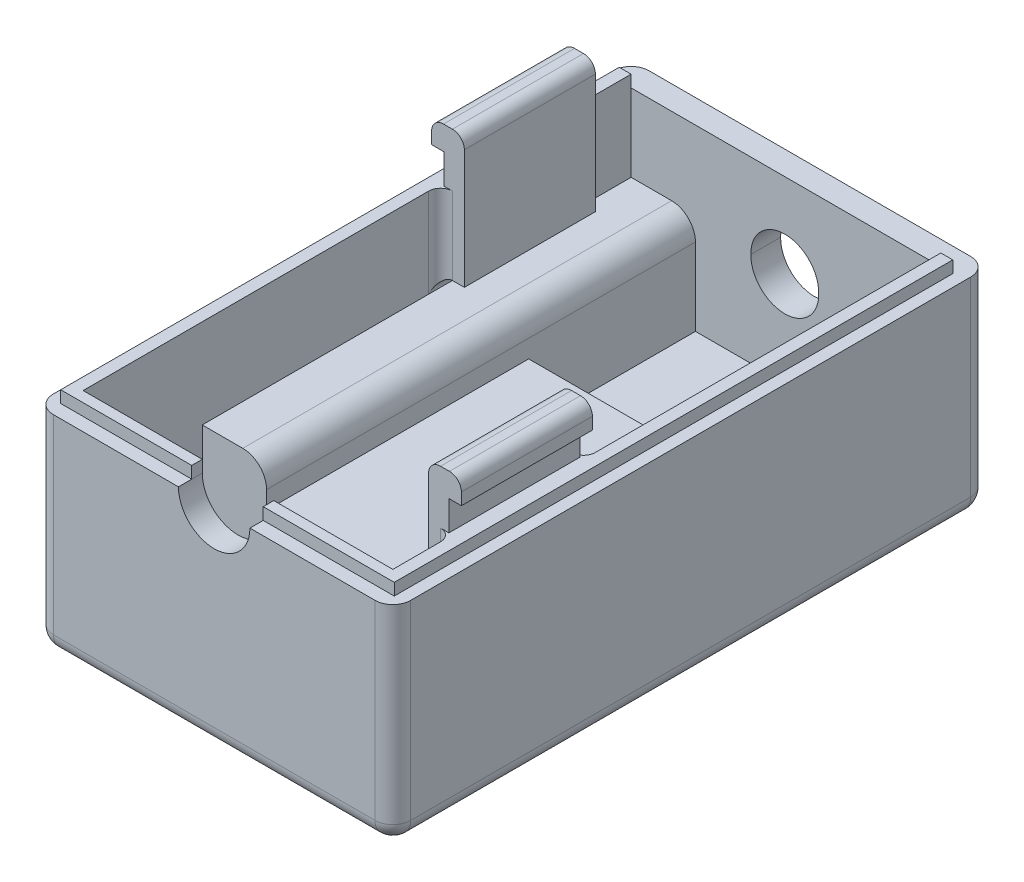
from build123d import *

# Parameters (mm, degrees)
BOSS_EXTRUDE1_DEPTH      = 17.5
CUT_EXTRUDE1_DEPTH       = 14
CUT_EXTRUDE2_DEPTH       = 54.247065647
SKETCH4_W                = 26
SKETCH4_H                = 8
CUT_EXTRUDE3_DEPTH       = 1
BOSS_EXTRUDE3_DEPTH      = 7.5
BOSS_EXTRUDE3_DEPTH_BACK = 1
SKETCH6_W                = 5.4
SKETCH6_H                = 36
FILLET2_R                = 2
FILLET5_R                = 1.5
SKETCH13_W               = 15.2
SKETCH13_H               = 28
BOSS_EXTRUDE7_DEPTH      = 4
SKETCH15_R               = 1
CUT_EXTRUDE8_DEPTH       = 6
CHAMFER5_SIZE            = 6
SKETCH16_W               = 11
SKETCH16_H               = 5.5
BOSS_EXTRUDE8_DEPTH      = 2
SKETCH17_W               = 11
SKETCH17_H               = 5.5
BOSS_EXTRUDE9_DEPTH      = 2
BOSS_EXTRUDE14_START     = -2
BOSS_EXTRUDE14_DEPTH     = 0.5
CHAMFER6_SIZE            = 0.5
BOSS_EXTRUDE15_DEPTH     = 0.5
CHAMFER7_SIZE            = 0.5
CUT_EXTRUDE9_REACH       = 59.483
BOSS_EXTRUDE16_DEPTH     = 1
FILLET7_R                = 1
SKETCH27_W               = 11
SKETCH27_H               = 2
BOSS_EXTRUDE17_DEPTH     = 0.75
SKETCH27_3_W             = 11
SKETCH27_3_H             = 2.5
CUT_EXTRUDE10_DEPTH      = 0.3
SKETCH29_W               = 11
SKETCH29_H               = 2
BOSS_EXTRUDE18_DEPTH     = 0.75
SKETCH29_4_W             = 11
SKETCH29_4_H             = 2.5
CUT_EXTRUDE11_DEPTH      = 0.3
FILLET8_R                = 1


# Some blends are built 0.0001 mm under size
with BuildPart() as part:
    # Sketch1 → Boss-Extrude1 (new body)
    with BuildSketch(Plane(origin=(0, 0, 0), x_dir=(1, 0, 0), z_dir=(0, 1, 0))):
        Polygon((-15, 20), (15, 20), (15, -20), (15, -30), (-15, -30), (-15, -20), align=None)
    extrude(amount=BOSS_EXTRUDE1_DEPTH)

    # Sketch2 → Cut-Extrude1 (cut)
    with BuildSketch(Plane(origin=(0, 17.5, 0), x_dir=(1, 0, 0), z_dir=(0, 1, 0))):
        Polygon((-13, 18), (13, 18), (13, -18), (13, -28), (-13, -28), (-13, -18), align=None)
    extrude(amount=-CUT_EXTRUDE1_DEPTH, mode=Mode.SUBTRACT)

    # Sketch3 → Cut-Extrude2 (cut, through all)
    with BuildSketch(Plane.XY.offset(-18)):
        with BuildLine():
            ThreePointArc((2.74956137, 10.425664385), (-0.1, 13.325664385), (-2.94956137, 10.425664385))
            ThreePointArc((-2.94956137, 10.425664385), (-0.1, 7.525664385), (2.74956137, 10.425664385))
        make_face()
    extrude(amount=-CUT_EXTRUDE2_DEPTH, mode=Mode.SUBTRACT)

    # Sketch4 → Cut-Extrude3 (cut)
    with BuildSketch(Plane(origin=(0, 3.5, 0), x_dir=(1, 0, 0), z_dir=(0, 1, 0))):
        with Locations((0, 14)):
            Rectangle(SKETCH4_W, SKETCH4_H)
    extrude(amount=-CUT_EXTRUDE3_DEPTH, mode=Mode.SUBTRACT)

    # Sketch6 → Boss-Extrude3 (add, two sides: drawn at the far end of the back side and taken through both)
    with BuildSketch(Plane(origin=(0, 3.5, 0), x_dir=(1, 0, 0), z_dir=(0, 1, 0)).offset(-BOSS_EXTRUDE3_DEPTH_BACK)):
        with Locations((-10.3, 0)):
            Rectangle(SKETCH6_W, SKETCH6_H)
        with Locations((10.3, 0)):
            Rectangle(SKETCH6_W, SKETCH6_H)
    extrude(amount=BOSS_EXTRUDE3_DEPTH + BOSS_EXTRUDE3_DEPTH_BACK)

    # Fillet2
    fillet2_edges = [part.edges().sort_by_distance(p)[0] for p in [
        (-7.6, 11, 0),
        (7.6, 11, 0),
    ]]
    fillet(fillet2_edges, radius=FILLET2_R)

    # Fillet5
    fillet5_edges = [part.edges().sort_by_distance(p)[0] for p in [
        (15, 8.75, 30),
        (-15, 8.75, 30),
        (-15, 8.75, -20),
        (15, 8.75, -20),
        (0, 0, 30),
        (-15, 0, 5),
        (0, 0, -20),
        (15, 0, 5),
    ]]
    fillet(fillet5_edges, radius=FILLET5_R)

    # Sketch13 → Boss-Extrude7 (add)
    with BuildSketch(Plane(origin=(0, 3.5, 0), x_dir=(1, 0, 0), z_dir=(0, 1, 0))):
        with Locations((0, -4)):
            Rectangle(SKETCH13_W, SKETCH13_H)
    extrude(amount=BOSS_EXTRUDE7_DEPTH)

    # Sketch15 → Cut-Extrude8 (cut)
    with BuildSketch(Plane(origin=(0, 7.5, 0), x_dir=(1, 0, 0), z_dir=(0, 1, 0))):
        with Locations(Location((0, -8.82, 0), (0, 0, 270))):
            Circle(SKETCH15_R)
    extrude(amount=-CUT_EXTRUDE8_DEPTH, mode=Mode.SUBTRACT)

    # Chamfer5
    # the kernel refuses this chamfer: 6 mm, written as the material it takes off along each edge
    with BuildSketch(Plane(origin=(-7.6, 7.5, -10), x_dir=(0, -0.9996219169112968, -0.02749587661058649), z_dir=(1, 0, 0))) as chamfer5_piece_1_section:
        Polygon((CHAMFER5_SIZE * 0.999621916911, -CHAMFER5_SIZE * 0.0274958766106), (-CHAMFER5_SIZE * 0.0274958766106, -CHAMFER5_SIZE * 0.999621916911), (0, 0), align=None)
    chamfer5_piece_1 = extrude(amount=15.2, mode=Mode.PRIVATE)
    chamfer5_piece_1 = split(chamfer5_piece_1, bisect_by=Plane(origin=(0, 2.5, -7.952380952), z_dir=(0, 1, 0)), keep=Keep.TOP, mode=Mode.PRIVATE)
    add(chamfer5_piece_1, mode=Mode.SUBTRACT)

    # Sketch16 → Boss-Extrude8 (add)
    with BuildSketch(Plane(origin=(-13, 0, 0), x_dir=(0, 0, -1), z_dir=(1, 0, 0))):
        Polygon((2, 17.5), (2, 14.5), (2, 12), (13, 12), (13, 14.5), (13, 17.5), align=None)
        with Locations((7.5, 20.25)):
            Rectangle(SKETCH16_W, SKETCH16_H)
    extrude(amount=BOSS_EXTRUDE8_DEPTH)

    # Sketch17 → Boss-Extrude9 (add)
    with BuildSketch(Plane.ZY.offset(-13)):
        with Locations((17.5, 20.25)):
            Rectangle(SKETCH17_W, SKETCH17_H)
        Polygon((12, 17.5), (12, 14.5), (12, 12), (23, 12), (23, 14.5), (23, 17.5), align=None)
    extrude(amount=BOSS_EXTRUDE9_DEPTH)

    # Sketch3<4> → Boss-Extrude14 (add)
    with BuildSketch(Plane.XY.offset(-18).offset(BOSS_EXTRUDE14_START)):
        Polygon((-4.129390667, 8.806636123), (-1.769028262, 6.446273719), (1.569028262, 6.446273719), (3.929390667, 8.806636123), (3.929390667, 12.144692648), (1.569028262, 14.505055052), (-1.769028262, 14.505055052), (-4.129390667, 12.144692648), align=None)
        with BuildLine():
            ThreePointArc((-2.94956137, 10.425664385), (-0.1, 7.525664385), (2.74956137, 10.425664385))
            ThreePointArc((2.74956137, 10.425664385), (-0.1, 13.325664385), (-2.94956137, 10.425664385))
        make_face(mode=Mode.SUBTRACT)
    extrude(amount=-BOSS_EXTRUDE14_DEPTH)

    # Chamfer6
    chamfer6_edges = [part.edges().sort_by_distance(p)[0] for p in [
        (2.749209465, 13.32487385, -20.5),
        (3.929390667, 10.475664385, -20.5),
        (2.749209465, 7.626454921, -20.5),
        (-0.1, 6.446273719, -20.5),
        (-2.949209465, 7.626454921, -20.5),
        (-4.129390667, 10.475664385, -20.5),
        (-2.949209465, 13.32487385, -20.5),
        (-0.1, 14.505055052, -20.5),
    ]]
    chamfer(chamfer6_edges, length=CHAMFER6_SIZE - 0.0001)  # a hair under: the kernel refuses the full size

    # Sketch23 → Boss-Extrude15 (add)
    with BuildSketch(Plane.XZ):
        Polygon((-12, 17), (-12, -17), (12, -17), (12, 17), (12, 27), (-12, 27), align=None)
    extrude(amount=BOSS_EXTRUDE15_DEPTH)

    # Chamfer7
    chamfer7_edges = [part.edges().sort_by_distance(p)[0] for p in [
        (12, -0.5, 5),
        (-12, -0.5, 5),
        (0, -0.5, -17),
        (0, -0.5, 27),
    ]]
    chamfer(chamfer7_edges, length=CHAMFER7_SIZE - 0.0001)  # a hair under: the kernel refuses the full size

    # Sketch24 → Cut-Extrude9 (cut, up to next)
    with BuildSketch(Plane.XY.offset(30), mode=Mode.PRIVATE) as cut_extrude9_sk1:
        with BuildLine():
            Line((-3, 17.5), (3, 17.5))
            ThreePointArc((3, 17.5), (0, 14.5), (-3, 17.5))
        make_face()
    cut_extrude9_tool1 = extrude(cut_extrude9_sk1.sketch, amount=-CUT_EXTRUDE9_REACH, mode=Mode.PRIVATE) & part.part
    add(cut_extrude9_tool1.solids().sort_by_distance((0, 16.22676, 30))[0], mode=Mode.SUBTRACT)

    # Sketch26 → Boss-Extrude16 (add)
    with BuildSketch(Plane(origin=(0, 17.5, 0), x_dir=(1, 0, 0), z_dir=(0, 1, 0))):
        Polygon((-13, 13), (-13, 18), (-14, 18), (-14, -19.115845085), (-14, -28.884154915), (-3, -28.884154915), (-3, -28), (-13, -28), (-13, 2), align=None)
        Polygon((3, -28), (13, -28), (13, 18), (14, 18), (14, -28.884154915), (3, -28.884154915), align=None)
    extrude(amount=BOSS_EXTRUDE16_DEPTH)

    # Fillet7
    fillet7_edges = [part.edges().sort_by_distance(p)[0] for p in [
        (-13, 15.25, -13),
        (-13, 15.25, -2),
        (-13, 12, -7.5),
        (13, 15.25, 12),
        (13, 12, 17.5),
        (13, 15.25, 23),
        (0, 3.5, 18),
    ]]
    fillet(fillet7_edges, radius=FILLET7_R - 0.0001)  # a hair under: the kernel refuses the full size

    # Sketch27 → Boss-Extrude17 (add)
    with BuildSketch(Plane.ZY.offset(13)):
        with Locations((-7.5, 22)):
            Rectangle(SKETCH27_W, SKETCH27_H)
    extrude(amount=BOSS_EXTRUDE17_DEPTH)

    # Sketch27<3> → Cut-Extrude10 (cut)
    with BuildSketch(Plane.ZY.offset(13)):
        with Locations((-7.5, 19.75)):
            Rectangle(SKETCH27_3_W, SKETCH27_3_H)
    extrude(amount=-CUT_EXTRUDE10_DEPTH, mode=Mode.SUBTRACT)

    # Sketch29 → Boss-Extrude18 (add)
    with BuildSketch(Plane(origin=(13, 0, 0), x_dir=(0, 0, -1), z_dir=(1, 0, 0))):
        with Locations((-17.5, 22)):
            Rectangle(SKETCH29_W, SKETCH29_H)
    extrude(amount=BOSS_EXTRUDE18_DEPTH)

    # Sketch29<4> → Cut-Extrude11 (cut)
    with BuildSketch(Plane(origin=(13, 0, 0), x_dir=(0, 0, -1), z_dir=(1, 0, 0))):
        with Locations((-17.5, 19.75)):
            Rectangle(SKETCH29_4_W, SKETCH29_4_H)
    extrude(amount=-CUT_EXTRUDE11_DEPTH, mode=Mode.SUBTRACT)

    # Fillet8
    fillet8_edges = [part.edges().sort_by_distance(p)[0] for p in [
        (-11, 23, -7.5),
        (11, 23, 17.5),
        (-13.75, 23, -7.5),
        (13.75, 23, 17.5),
    ]]
    fillet(fillet8_edges, radius=FILLET8_R)


solid = part.part
